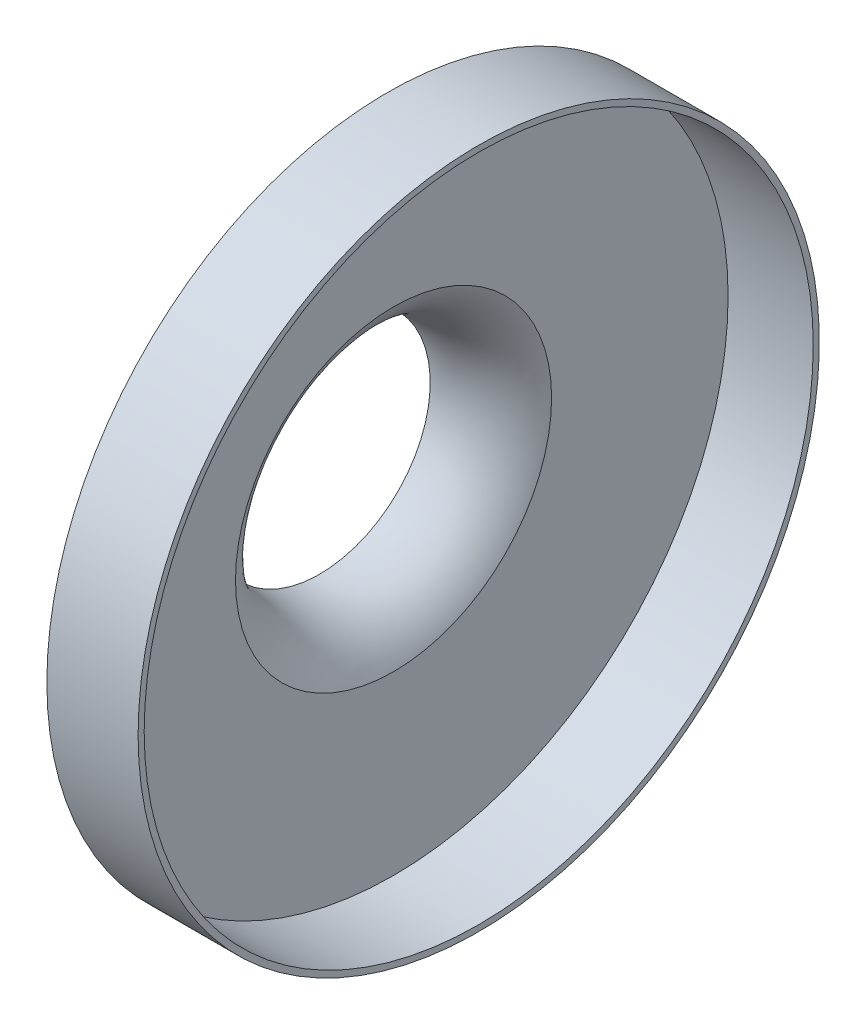
from build123d import *


with BuildPart() as part:
    # Sketch1 → Revolve1 (revolve)
    with BuildSketch(Plane.XY):
        with BuildLine():
            Line((15.446351252, 33.000061), (15.446351252, 69.85))
            Line((15.446351252, 69.85), (33.226351252, 69.85))
            Line((33.226351252, 69.85), (33.226351252, 71.12))
            Line((33.226351252, 71.12), (14.176351252, 71.12))
            Line((14.176351252, 71.12), (14.176351252, 33.283626325))
            ThreePointArc((14.176351252, 33.283626325), (8.372889798, 26.783594579), (0, 24.37003))
            Line((0, 24.37003), (0, 23.10003))
            ThreePointArc((0, 23.10003), (9.1733361, 25.787457832), (15.446351252, 33.000061))
        make_face()
    revolve(axis=Axis((0, 0, 0), (1, 0, 0)))


solid = part.part
